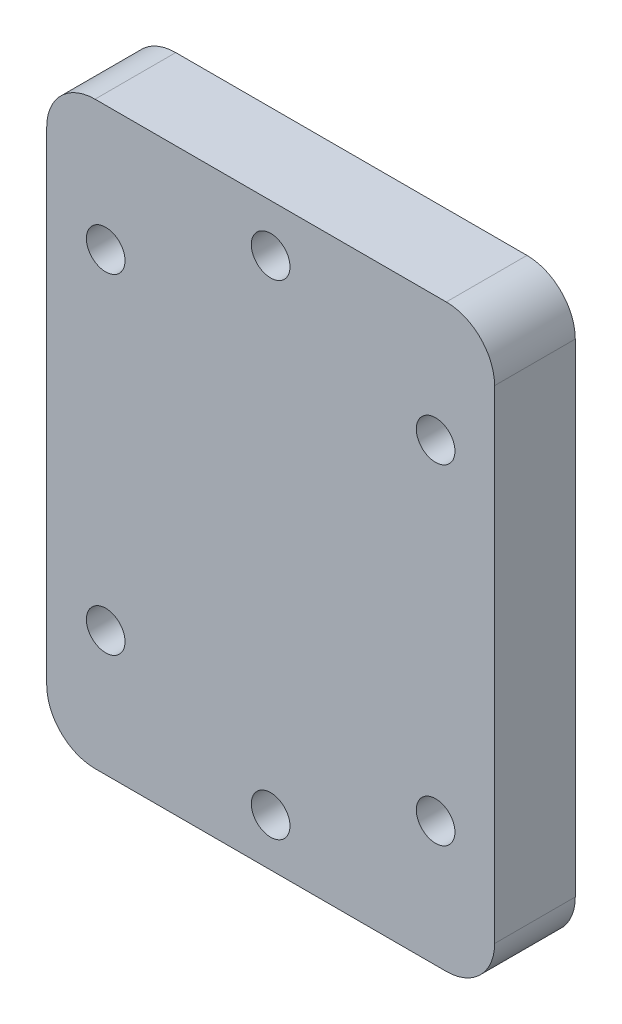
from build123d import *

# Parameters (mm, degrees)
BOSS_EXTRUDE1_DEPTH      = 2
BOSS_EXTRUDE1_DEPTH_BACK = 6.35
SKETCH1_W                = 46.35
SKETCH1_H                = 60
SKETCH1_R                = 2
SKETCH2_W                = 30
SKETCH2_H                = 30
CUT_EXTRUDE1_DEPTH       = 6.35
SKETCH4_R                = 2
BOSS_EXTRUDE4_DEPTH      = 0.85
FILLET1_R                = 5


with BuildPart() as part:
    # Sketch1 → Boss-Extrude1 (new, two sides: drawn at the far end of the back side and taken through both)
    with BuildSketch(Plane.XY.offset(-BOSS_EXTRUDE1_DEPTH_BACK)):
        Rectangle(SKETCH1_W, SKETCH1_H)
        with Locations((-17.071067812, -17.071067812)):
            Circle(SKETCH1_R, mode=Mode.SUBTRACT)
        with Locations((0, -25.060622825)):
            Circle(SKETCH1_R, mode=Mode.SUBTRACT)
        with Locations((17.071067812, -17.071067812)):
            Circle(SKETCH1_R, mode=Mode.SUBTRACT)
        with Locations((-17.071067812, 17.071067812)):
            Circle(SKETCH1_R, mode=Mode.SUBTRACT)
        with Locations((0, 25.060622825)):
            Circle(SKETCH1_R, mode=Mode.SUBTRACT)
        with Locations((17.071067812, 17.071067812)):
            Circle(SKETCH1_R, mode=Mode.SUBTRACT)
    extrude(amount=BOSS_EXTRUDE1_DEPTH + BOSS_EXTRUDE1_DEPTH_BACK)

    # Sketch2 → Cut-Extrude1 (cut)
    with BuildSketch(Plane(origin=(0, 0, -6.35), x_dir=(-1, 0, 0), z_dir=(0, 0, -1))):
        Rectangle(SKETCH2_W, SKETCH2_H)
    extrude(amount=-CUT_EXTRUDE1_DEPTH, mode=Mode.SUBTRACT)

    # Sketch4 → Boss-Extrude4 (add)
    with BuildSketch(Plane(origin=(0, 0, -6.35), x_dir=(-1, 0, 0), z_dir=(0, 0, -1))):
        with Locations((-17.071067812, 17.071067812)):
            Circle(SKETCH4_R)
        with Locations((17.071067812, 17.071067812)):
            Circle(SKETCH4_R)
        with Locations((-17.071067812, -17.071067812)):
            Circle(SKETCH4_R)
        with Locations((17.071067812, -17.071067812)):
            Circle(SKETCH4_R)
    extrude(amount=-BOSS_EXTRUDE4_DEPTH)

    # Fillet1
    fillet1_edges = [part.edges().sort_by_distance(p)[0] for p in [
        (23.175, 30, -2.175),
        (-23.175, 30, -2.175),
        (-23.175, -30, -2.175),
        (23.175, -30, -2.175),
    ]]
    fillet(fillet1_edges, radius=FILLET1_R)


solid = part.part
